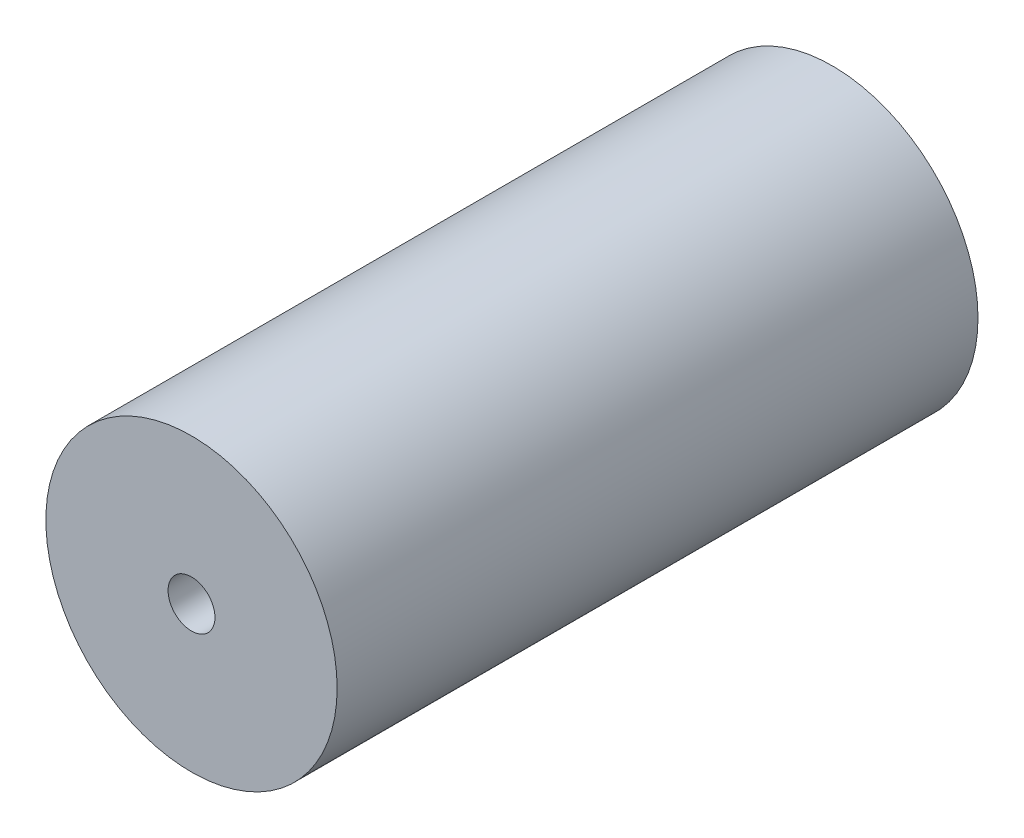
from build123d import *

# Parameters (mm, degrees)
SKIZZE1_R                       = 25
SKIZZE1_R_2                     = 4.025
AUFSATZ_LINEAR_AUSTRAGEN1_DEPTH = 110


with BuildPart() as part:
    # Skizze1 → Aufsatz-Linear austragen1 (new body)
    with BuildSketch(Plane.XY):
        Circle(SKIZZE1_R)
        Circle(SKIZZE1_R_2, mode=Mode.SUBTRACT)
    extrude(amount=AUFSATZ_LINEAR_AUSTRAGEN1_DEPTH)


solid = part.part
